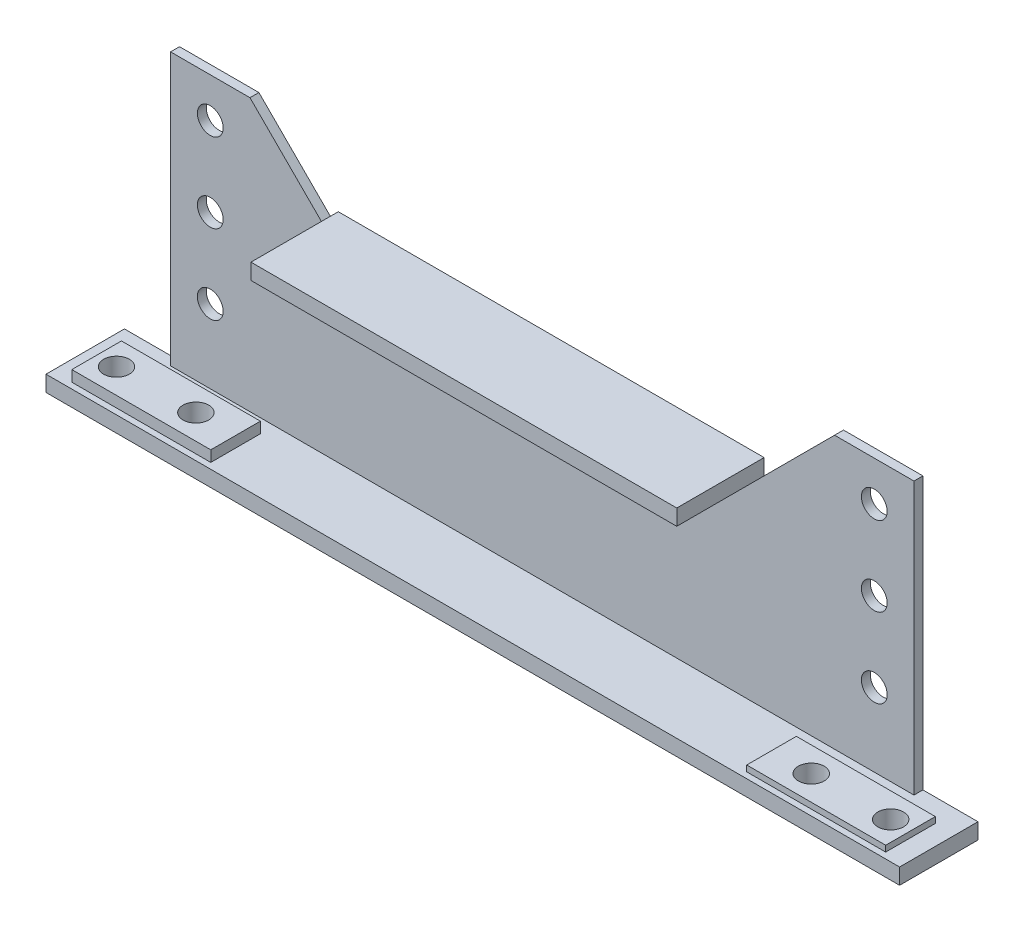
from build123d import *

# Parameters (mm, degrees)
SKETCH_1_R             = 13
EXTRUDE_2_DEPTH        = 9
SKETCH_3_W             = 860
SKETCH_3_H             = 16
EXTRUDE_3_DEPTH        = 70
SKETCH_4_W             = 140
SKETCH_4_H             = 50
EXTRUDE_5_DEPTH        = 11
SKETCH_5_R             = 13
CUT_EXTRUDE_2_DEPTH    = 903.779042734
PATTERN_LINEAR_1_COUNT = 2
PATTERN_LINEAR_1_PITCH = 80
SKETCH_6_W             = 140
SKETCH_6_H             = 50
EXTRUDE_6_DEPTH        = 6
SKETCH_7_R             = 13
CUT_EXTRUDE_3_DEPTH    = 905.248306606
PATTERN_LINEAR_2_COUNT = 2
PATTERN_LINEAR_2_PITCH = 80
SKETCH_10_W            = 429
SKETCH_10_H            = 16
EXTRUDE_8_DEPTH        = 79


with BuildPart() as part:
    # 草图1 → 凸台-拉伸2 (new body)
    with BuildSketch(Plane.XY):
        Polygon((0, 0), (860, 0), (860, 16), (804.5, 16), (804.5, 290), (724.5, 290), (644.5, 210), (644.5, 226), (215.5, 226), (215.5, 210), (135.5, 290), (55.5, 290), (55.5, 16), (0, 16), align=None)
        with Locations((95.5, 90)):
            Circle(SKETCH_1_R, mode=Mode.SUBTRACT)
        with Locations((95.5, 170)):
            Circle(SKETCH_1_R, mode=Mode.SUBTRACT)
        with Locations((95.5, 250)):
            Circle(SKETCH_1_R, mode=Mode.SUBTRACT)
        with Locations((764.5, 90)):
            Circle(SKETCH_1_R, mode=Mode.SUBTRACT)
        with Locations((764.5, 170)):
            Circle(SKETCH_1_R, mode=Mode.SUBTRACT)
        with Locations((764.5, 250)):
            Circle(SKETCH_1_R, mode=Mode.SUBTRACT)
    extrude(amount=EXTRUDE_2_DEPTH)

    # 草图3 → 凸台-拉伸3 (add)
    with BuildSketch(Plane.XY.offset(9)):
        with Locations((430, 8)):
            Rectangle(SKETCH_3_W, SKETCH_3_H)
    extrude(amount=EXTRUDE_3_DEPTH)

    # 草图4 → 凸台-拉伸5 (add)
    with BuildSketch(Plane(origin=(0, 16, 0), x_dir=(1, 0, 0), z_dir=(0, 1, 0))):
        with Locations((90, -48)):
            Rectangle(SKETCH_4_W, SKETCH_4_H)
    extrude(amount=EXTRUDE_5_DEPTH)

    # 草图5 → 切除-拉伸2 (cut, through all)
    with BuildSketch(Plane(origin=(0, 27, 0), x_dir=(1, 0, 0), z_dir=(0, 1, 0))):
        with Locations((40, -48)):
            Circle(SKETCH_5_R)
    cut_extrude_2 = extrude(amount=-CUT_EXTRUDE_2_DEPTH, mode=Mode.SUBTRACT)

    # 阵列(线性)1: 切除-拉伸2 ×2
    with Locations(*[(i * PATTERN_LINEAR_1_PITCH, 0, 0) for i in range(1, PATTERN_LINEAR_1_COUNT)]):
        add(cut_extrude_2, mode=Mode.SUBTRACT)

    # 草图6 → 凸台-拉伸6 (add)
    with BuildSketch(Plane(origin=(0, 16, 0), x_dir=(1, 0, 0), z_dir=(0, 1, 0))):
        with Locations((770, -48)):
            Rectangle(SKETCH_6_W, SKETCH_6_H)
    extrude(amount=EXTRUDE_6_DEPTH)

    # 草图7 → 切除-拉伸3 (cut, through all)
    with BuildSketch(Plane(origin=(0, 22, 0), x_dir=(1, 0, 0), z_dir=(0, 1, 0))):
        with Locations((820, -48)):
            Circle(SKETCH_7_R)
    cut_extrude_3 = extrude(amount=-CUT_EXTRUDE_3_DEPTH, mode=Mode.SUBTRACT)

    # 阵列(线性)2: 切除-拉伸3 ×2
    with Locations(*[(-i * PATTERN_LINEAR_2_PITCH, 0, 0) for i in range(1, PATTERN_LINEAR_2_COUNT)]):
        add(cut_extrude_3, mode=Mode.SUBTRACT)

    # 草图10 → 凸台-拉伸8 (add)
    with BuildSketch(Plane.XY.offset(9)):
        with Locations((430, 218)):
            Rectangle(SKETCH_10_W, SKETCH_10_H)
    extrude(amount=EXTRUDE_8_DEPTH)


solid = part.part
